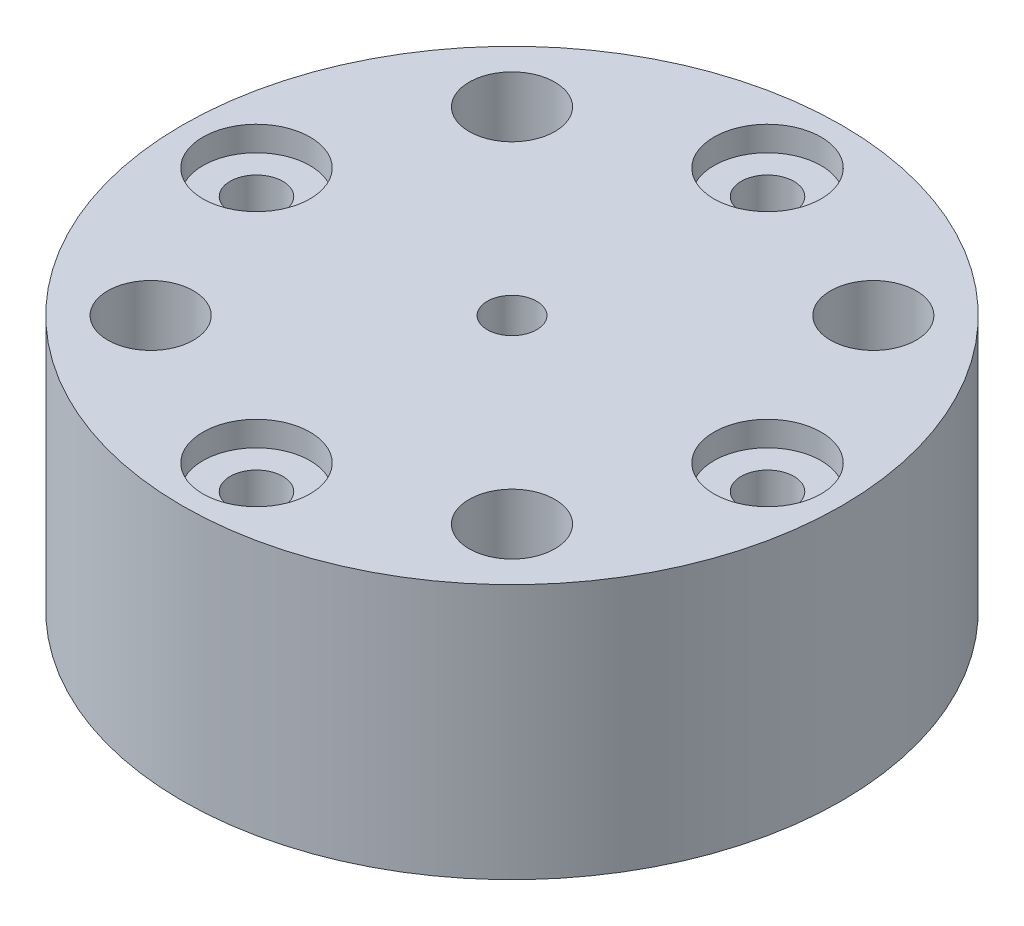
from build123d import *

# Parameters (mm, degrees)
SKETCH1_R           = 20
SKETCH1_R_2         = 1.6
SKETCH1_R_3         = 1.5
BOSS_EXTRUDE1_DEPTH = 15.5
SKETCH2_R           = 3.25
CUT_EXTRUDE1_DEPTH  = 1.5
SKETCH3_R           = 2.6
CUT_EXTRUDE2_DEPTH  = 10


with BuildPart() as part:
    # Sketch1 → Boss-Extrude1 (new body)
    with BuildSketch(Plane(origin=(0, 0, 0), x_dir=(1, 0, 0), z_dir=(0, 1, 0))):
        Circle(SKETCH1_R)
        with Locations((0, 15.5)):
            Circle(SKETCH1_R_2, mode=Mode.SUBTRACT)
        with Locations((15.5, 0)):
            Circle(SKETCH1_R_2, mode=Mode.SUBTRACT)
        with Locations((0, -15.5)):
            Circle(SKETCH1_R_2, mode=Mode.SUBTRACT)
        with Locations((-15.5, 0)):
            Circle(SKETCH1_R_2, mode=Mode.SUBTRACT)
        Circle(SKETCH1_R_3, mode=Mode.SUBTRACT)
    extrude(amount=BOSS_EXTRUDE1_DEPTH)

    # Sketch2 → Cut-Extrude1 (cut)
    with BuildSketch(Plane(origin=(0, 15.5, 0), x_dir=(1, 0, 0), z_dir=(0, 1, 0))):
        with Locations((0, 15.5)):
            Circle(SKETCH2_R)
        with Locations((15.5, 0)):
            Circle(SKETCH2_R)
        with Locations((0, -15.5)):
            Circle(SKETCH2_R)
        with Locations((-15.5, 0)):
            Circle(SKETCH2_R)
    extrude(amount=-CUT_EXTRUDE1_DEPTH, mode=Mode.SUBTRACT)

    # Sketch3 → Cut-Extrude2 (cut)
    with BuildSketch(Plane(origin=(0, 15.5, 0), x_dir=(1, 0, 0), z_dir=(0, 1, 0))):
        with Locations((-10.960155108, 10.960155108)):
            Circle(SKETCH3_R)
        with Locations((10.960155108, 10.960155108)):
            Circle(SKETCH3_R)
        with Locations((10.960155108, -10.960155108)):
            Circle(SKETCH3_R)
        with Locations((-10.960155108, -10.960155108)):
            Circle(SKETCH3_R)
    extrude(amount=-CUT_EXTRUDE2_DEPTH, mode=Mode.SUBTRACT)


solid = part.part
